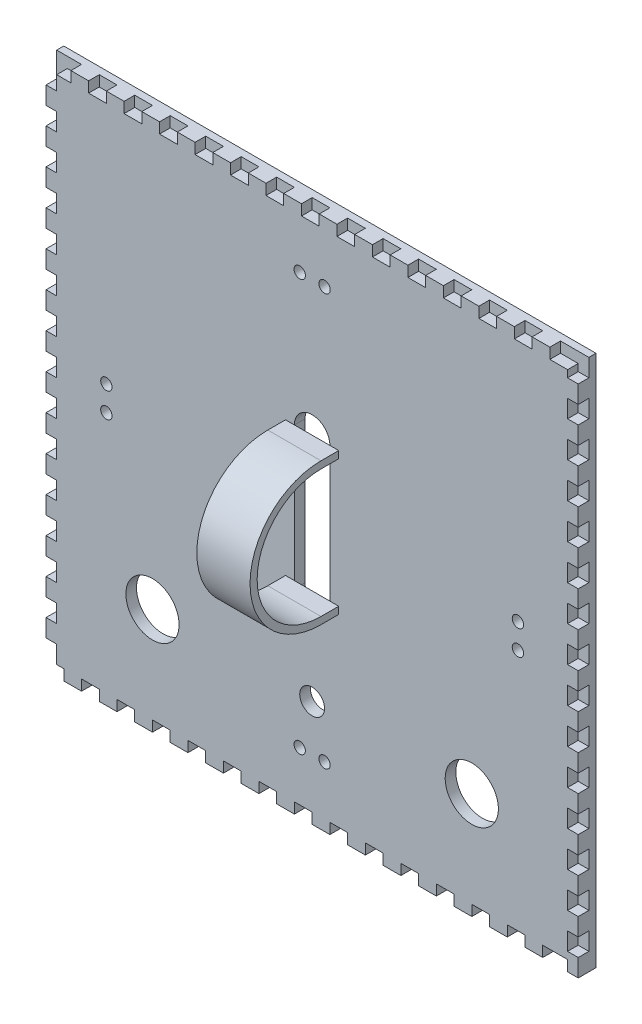
from build123d import *

# Parameters (mm, degrees)
SKETCH1_W           = 150
SKETCH1_H           = 150
BOSS_EXTRUDE1_DEPTH = 5
SKETCH2_W           = 130
SKETCH2_H           = 130
CUT_EXTRUDE1_DEPTH  = 2
CUT_EXTRUDE2_DEPTH  = 107.108435103
SKETCH4_W           = 3
SKETCH4_H           = 5
CUT_EXTRUDE3_DEPTH  = 3
LPATTERN1_COUNT     = 15
LPATTERN1_PITCH     = 10
SKETCH5_W           = 7
SKETCH5_H           = 3
CUT_EXTRUDE4_DEPTH  = 3
SKETCH6_W           = 5
SKETCH6_H           = 3
CUT_EXTRUDE5_DEPTH  = 3
LPATTERN2_COUNT     = 14
LPATTERN2_PITCH     = 10
SKETCH7_W           = 5
SKETCH7_H           = 3
CUT_EXTRUDE6_DEPTH  = 3
LPATTERN3_COUNT     = 15
LPATTERN3_PITCH     = 10
SKETCH8_W           = 2
SKETCH8_H           = 3
CUT_EXTRUDE7_DEPTH  = 3
SKETCH9_W           = 3
SKETCH9_H           = 4
CUT_EXTRUDE8_DEPTH  = 3
SKETCH10_W          = 3
SKETCH10_H          = 5
CUT_EXTRUDE9_DEPTH  = 3
LPATTERN4_COUNT     = 14
LPATTERN4_PITCH     = 10
SKETCH11_R          = 1.6
CUT_EXTRUDE10_DEPTH = 15
SKETCH12_R          = 1.6
CUT_EXTRUDE11_DEPTH = 15
BOSS_EXTRUDE2_DEPTH = 7.5
SKETCH16_R          = 7.5
SKETCH16_R_2        = 3.5
CUT_EXTRUDE12_DEPTH = 10


with BuildPart() as part:
    # Sketch1 → Boss-Extrude1 (new body)
    with BuildSketch(Plane.XY):
        Rectangle(SKETCH1_W, SKETCH1_H)
    extrude(amount=BOSS_EXTRUDE1_DEPTH)

    # Sketch2 → Cut-Extrude1 (cut)
    with BuildSketch(Plane(origin=(0, 0, 0), x_dir=(-1, 0, 0), z_dir=(0, 0, -1))):
        Rectangle(SKETCH2_W, SKETCH2_H)
    extrude(amount=-CUT_EXTRUDE1_DEPTH, mode=Mode.SUBTRACT)

    # Sketch3 → Cut-Extrude2 (cut, through all)
    with BuildSketch(Plane(origin=(0, 0, 2), x_dir=(-1, 0, 0), z_dir=(0, 0, -1))):
        with BuildLine():
            Line((5, 20), (5, -20))
            ThreePointArc((5, -20), (0, -25), (-5, -20))
            Line((-5, -20), (-5, 20))
            ThreePointArc((-5, 20), (0, 25), (5, 20))
        make_face()
    extrude(amount=-CUT_EXTRUDE2_DEPTH, mode=Mode.SUBTRACT)

    # Sketch4 → Cut-Extrude3 (cut)
    with BuildSketch(Plane(origin=(75, 0, 0), x_dir=(0, 0, -1), z_dir=(1, 0, 0))):
        with Locations((-3.5, 72.5)):
            Rectangle(SKETCH4_W, SKETCH4_H)
    cut_extrude3 = extrude(amount=-CUT_EXTRUDE3_DEPTH, mode=Mode.SUBTRACT)

    # LPattern1: Cut-Extrude3 ×15
    with Locations(*[(0, -i * LPATTERN1_PITCH, 0) for i in range(1, LPATTERN1_COUNT)]):
        add(cut_extrude3, mode=Mode.SUBTRACT)

    # Sketch5 → Cut-Extrude4 (cut)
    with BuildSketch(Plane.XZ.offset(75)):
        with Locations((68.5, 3.5)):
            Rectangle(SKETCH5_W, SKETCH5_H)
    extrude(amount=-CUT_EXTRUDE4_DEPTH, mode=Mode.SUBTRACT)

    # Sketch6 → Cut-Extrude5 (cut)
    with BuildSketch(Plane.XZ.offset(75)):
        with Locations((57.5, 3.5)):
            Rectangle(SKETCH6_W, SKETCH6_H)
    cut_extrude5 = extrude(amount=-CUT_EXTRUDE5_DEPTH, mode=Mode.SUBTRACT)

    # LPattern2: Cut-Extrude5 ×14
    with Locations(*[(-i * LPATTERN2_PITCH, 0, 0) for i in range(1, LPATTERN2_COUNT)]):
        add(cut_extrude5, mode=Mode.SUBTRACT)

    # Sketch7 → Cut-Extrude6 (cut)
    with BuildSketch(Plane(origin=(0, 75, 0), x_dir=(1, 0, 0), z_dir=(0, 1, 0))):
        with Locations((69.5, -3.5)):
            Rectangle(SKETCH7_W, SKETCH7_H)
    cut_extrude6 = extrude(amount=-CUT_EXTRUDE6_DEPTH, mode=Mode.SUBTRACT)

    # LPattern3: Cut-Extrude6 ×15
    with Locations(*[(-i * LPATTERN3_PITCH, 0, 0) for i in range(1, LPATTERN3_COUNT)]):
        add(cut_extrude6, mode=Mode.SUBTRACT)

    # Sketch8 → Cut-Extrude7 (cut)
    with BuildSketch(Plane(origin=(0, 75, 0), x_dir=(1, 0, 0), z_dir=(0, 1, 0))):
        with Locations((-74, -3.5)):
            Rectangle(SKETCH8_W, SKETCH8_H)
    extrude(amount=-CUT_EXTRUDE7_DEPTH, mode=Mode.SUBTRACT)

    # Sketch9 → Cut-Extrude8 (cut)
    with BuildSketch(Plane.ZY.offset(75)):
        with Locations((3.5, 70)):
            Rectangle(SKETCH9_W, SKETCH9_H)
    extrude(amount=-CUT_EXTRUDE8_DEPTH, mode=Mode.SUBTRACT)

    # Sketch10 → Cut-Extrude9 (cut)
    with BuildSketch(Plane.ZY.offset(75)):
        with Locations((3.5, 60.5)):
            Rectangle(SKETCH10_W, SKETCH10_H)
    cut_extrude9 = extrude(amount=-CUT_EXTRUDE9_DEPTH, mode=Mode.SUBTRACT)

    # LPattern4: Cut-Extrude9 ×14
    with Locations(*[(0, -i * LPATTERN4_PITCH, 0) for i in range(1, LPATTERN4_COUNT)]):
        add(cut_extrude9, mode=Mode.SUBTRACT)

    # Sketch11 → Cut-Extrude10 (cut)
    with BuildSketch(Plane(origin=(0, 0, 0), x_dir=(-1, 0, 0), z_dir=(0, 0, -1))):
        with Locations((-58, 3.5)):
            Circle(SKETCH11_R)
        with Locations((-58, -3.5)):
            Circle(SKETCH11_R)
    cut_extrude10 = extrude(amount=-CUT_EXTRUDE10_DEPTH, mode=Mode.SUBTRACT)

    # Mirror1: Cut-Extrude10 across plane
    add(cut_extrude10.mirror(Plane(origin=(0, 0, 0), x_dir=(0, 0, 1), z_dir=(1, 0, 0))), mode=Mode.SUBTRACT)

    # Sketch12 → Cut-Extrude11 (cut)
    with BuildSketch(Plane(origin=(0, 0, 0), x_dir=(-1, 0, 0), z_dir=(0, 0, -1))):
        with Locations((3.5, -58)):
            Circle(SKETCH12_R)
        with Locations((-3.5, -58)):
            Circle(SKETCH12_R)
    cut_extrude11 = extrude(amount=-CUT_EXTRUDE11_DEPTH, mode=Mode.SUBTRACT)

    # Mirror2: Cut-Extrude11 across plane
    add(cut_extrude11.mirror(Plane.ZX), mode=Mode.SUBTRACT)

    # Sketch16 → Cut-Extrude12 (cut)
    with BuildSketch(Plane(origin=(0, 0, 2), x_dir=(-1, 0, 0), z_dir=(0, 0, -1))):
        with Locations((45, -45)):
            Circle(SKETCH16_R)
        with Locations((-45, -45)):
            Circle(SKETCH16_R)
        with Locations((0, -45)):
            Circle(SKETCH16_R_2)
    extrude(amount=-CUT_EXTRUDE12_DEPTH, mode=Mode.SUBTRACT)


with BuildPart() as body_2:
    # Sketch15 → Boss-Extrude2 (new, symmetric)
    with BuildSketch(Plane(origin=(0, 0, 0), x_dir=(0, 0, -1), z_dir=(1, 0, 0))):
        with BuildLine():
            Line((-5, 18), (-10, 18))
            ThreePointArc((-10, 18), (-28, 0), (-10, -18))
            Line((-10, -18), (-5, -18))
            Line((-5, -18), (-5, -20))
            Line((-5, -20), (-10, -20))
            ThreePointArc((-10, -20), (-30, 0), (-10, 20))
            Line((-10, 20), (-5, 20))
            Line((-5, 20), (-5, 18))
        make_face()
    extrude(amount=BOSS_EXTRUDE2_DEPTH, both=True)


solid = Compound([part.part, body_2.part])
